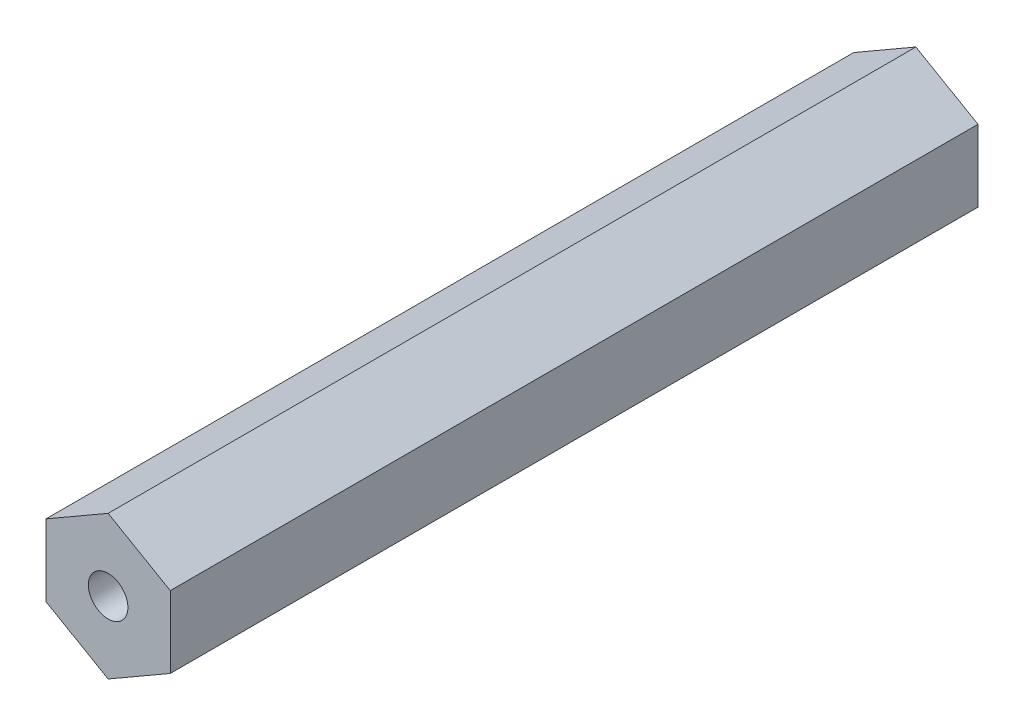
from build123d import *

# Parameters (mm, degrees)
BOSS_EXTRUDE1_DEPTH = 41.275


with BuildPart() as part:
    # Sketch1 → Boss-Extrude1 (new, symmetric)
    with BuildSketch(Plane.XY):
        Polygon((0, 7.332348419), (-6.35, 3.666174209), (-6.35, -3.666174209), (0, -7.332348419), (6.35, -3.666174209), (6.35, 3.666174209), align=None)
    extrude(amount=BOSS_EXTRUDE1_DEPTH, both=True)

    # Sketch5 → #10-32 Tapped Hole1 (revolve, cut)
    with BuildSketch(Plane(origin=(0, 0, -41.275), x_dir=(0, 1, 0), z_dir=(1, 0, 0))):
        Polygon((0, 0), (0, 13.151317848), (2.0193, 11.938), (2.0193, 0), align=None)
    f_10_32_tapped_hole1 = revolve(axis=Axis((0, 0, -47.625), (0, 0, 1)), mode=Mode.SUBTRACT)

    # Mirror1: #10-32 Tapped Hole1 across plane
    add(f_10_32_tapped_hole1.mirror(Plane.XY), mode=Mode.SUBTRACT)


solid = part.part
